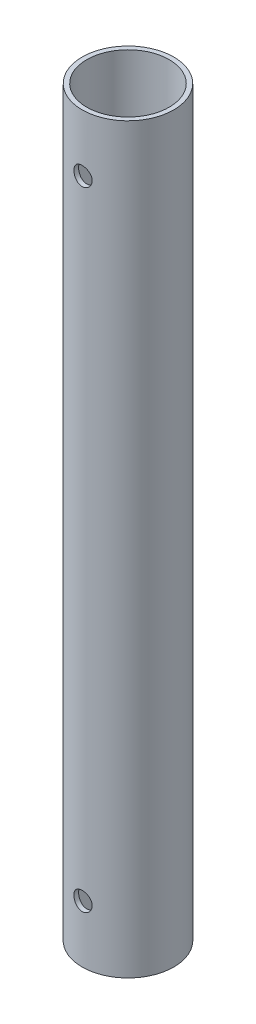
from build123d import *

# Parameters (mm, degrees)
SKETCH1_R           = 10
SKETCH1_R_2         = 9
BOSS_EXTRUDE1_DEPTH = 162
SKETCH3_R           = 2
CUT_EXTRUDE2_DEPTH  = 164.535928774


with BuildPart() as part:
    # Sketch1 → Boss-Extrude1 (new body)
    with BuildSketch(Plane(origin=(0, 0, 0), x_dir=(1, 0, 0), z_dir=(0, 1, 0))):
        Circle(SKETCH1_R)
        Circle(SKETCH1_R_2, mode=Mode.SUBTRACT)
    extrude(amount=BOSS_EXTRUDE1_DEPTH)

    # Sketch3 → Cut-Extrude2 (cut, through all)
    with BuildSketch(Plane.XY.offset(10)):
        with Locations((0, 149.5)):
            Circle(SKETCH3_R)
        with Locations((0, 12.5)):
            Circle(SKETCH3_R)
    extrude(amount=-CUT_EXTRUDE2_DEPTH, mode=Mode.SUBTRACT)


solid = part.part
